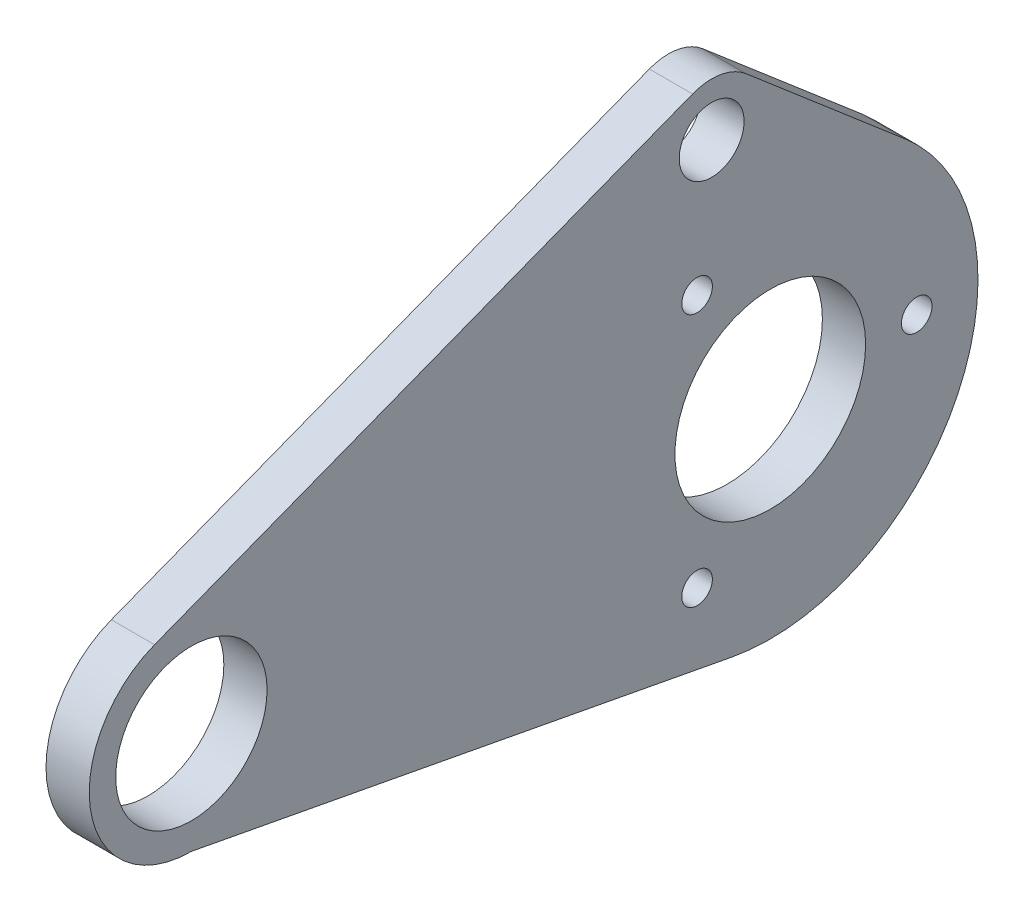
from build123d import *

# Parameters (mm, degrees)
SKETCH1_R            = 11.1125
SKETCH1_R_2          = 14
SKETCH1_R_3          = 4.7625
BOSS_EXTRUDE1_DEPTH  = 3.175
M4_CLEARANCE_HOLE1_D = 4.5


with BuildPart() as part:
    # Sketch1 → Boss-Extrude1 (new, symmetric)
    with BuildSketch(Plane(origin=(0, 0, 0), x_dir=(0, 0, -1), z_dir=(1, 0, 0))):
        with BuildLine():
            Line((73.589867092, 44.521343816), (-5.407259882, 13.991481))
            ThreePointArc((-5.407259882, 13.991481), (-14.745714886, -2.750253171), (0, -15))
            Line((0, -15), (79.344909163, -29.971151924))
            ThreePointArc((79.344909163, -29.971151924), (112.50372992, -13.183127113), (104.821761092, 23.180763301))
            Line((104.821761092, 23.180763301), (81.432924752, 43.180446665))
            ThreePointArc((81.432924752, 43.180446665), (77.696268156, 44.932233649), (73.589867092, 44.521343816))
        make_face()
        Circle(SKETCH1_R, mode=Mode.SUBTRACT)
        with Locations((85, 0)):
            Circle(SKETCH1_R_2, mode=Mode.SUBTRACT)
        with Locations((76.388124081, 37.280752399)):
            Circle(SKETCH1_R_3, mode=Mode.SUBTRACT)
    extrude(amount=BOSS_EXTRUDE1_DEPTH, both=True)

    # M4 Clearance Hole1 (through all)
    with Locations(Plane(origin=(3.175, 0, 0), x_dir=(0, 0, -1), z_dir=(1, 0, 0))):
        with Locations((74.25, 18.619546181), (106.5, 0), (74.25, -18.619546181)):
            Hole(M4_CLEARANCE_HOLE1_D / 2)


solid = part.part
